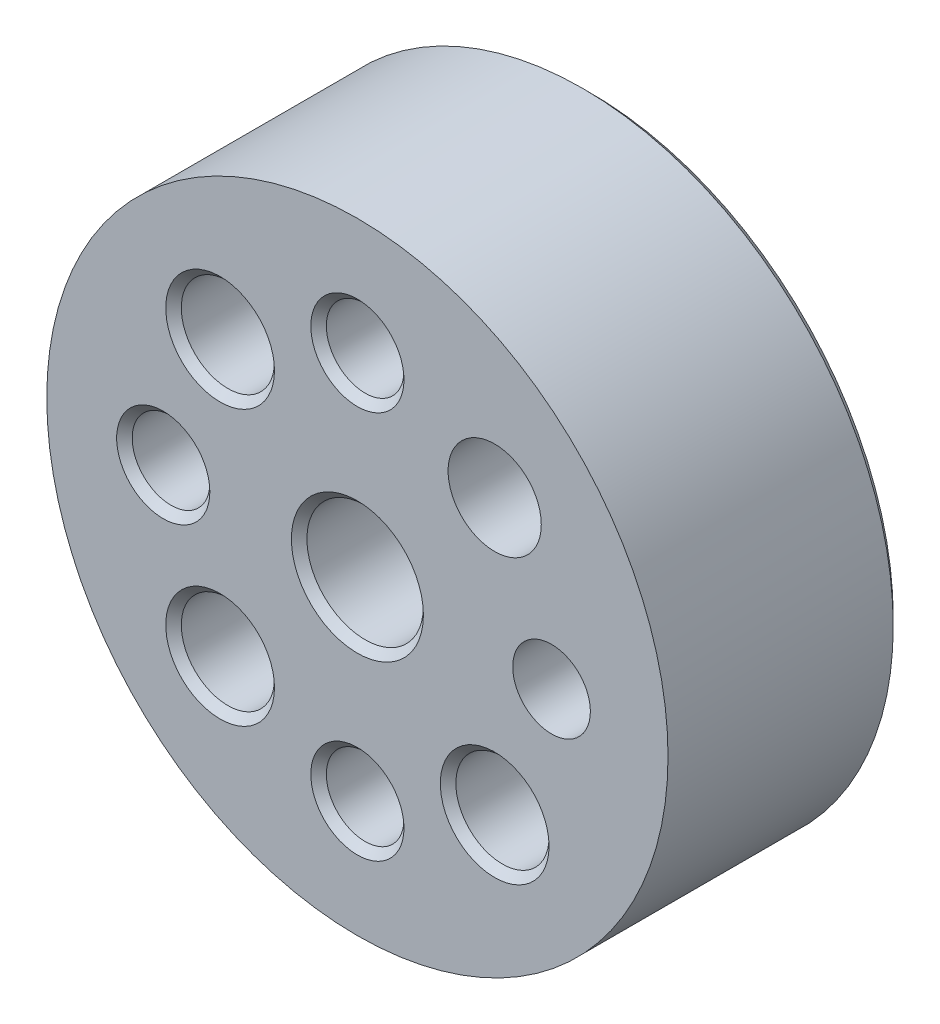
from build123d import *

# Parameters (mm, degrees)
SKIZZE1_R                       = 40
AUFSATZ_LINEAR_AUSTRAGEN1_DEPTH = 30
SKIZZE2_R                       = 5
SCHNITT_LINEAR_AUSTRAGEN1_DEPTH = 25
SKIZZE4_R                       = 6
SCHNITT_LINEAR_AUSTRAGEN5_DEPTH = 25
SKIZZE5_R                       = 7.5
SCHNITT_LINEAR_AUSTRAGEN6_DEPTH = 25
FASE1_SIZE                      = 1


with BuildPart() as part:
    # Skizze1 → Aufsatz-Linear austragen1 (new body)
    with BuildSketch(Plane.XY):
        Circle(SKIZZE1_R)
    extrude(amount=AUFSATZ_LINEAR_AUSTRAGEN1_DEPTH)

    # Skizze2 → Schnitt-Linear austragen1 (cut)
    with BuildSketch(Plane.XY.offset(30)):
        with Locations((25, 0)):
            Circle(SKIZZE2_R)
        with Locations((0, -25)):
            Circle(SKIZZE2_R)
        with Locations((-25, 0)):
            Circle(SKIZZE2_R)
        with Locations((0, 25)):
            Circle(SKIZZE2_R)
    extrude(amount=-SCHNITT_LINEAR_AUSTRAGEN1_DEPTH, mode=Mode.SUBTRACT)

    # Skizze4 → Schnitt-Linear austragen5 (cut)
    with BuildSketch(Plane.XY.offset(30)):
        with Locations((17.67766953, 17.67766953)):
            Circle(SKIZZE4_R)
        with Locations((17.67766953, -17.67766953)):
            Circle(SKIZZE4_R)
        with Locations((-17.67766953, -17.67766953)):
            Circle(SKIZZE4_R)
        with Locations((-17.67766953, 17.67766953)):
            Circle(SKIZZE4_R)
    extrude(amount=-SCHNITT_LINEAR_AUSTRAGEN5_DEPTH, mode=Mode.SUBTRACT)

    # Skizze5 → Schnitt-Linear austragen6 (cut)
    with BuildSketch(Plane.XY.offset(30)):
        Circle(SKIZZE5_R)
    extrude(amount=-SCHNITT_LINEAR_AUSTRAGEN6_DEPTH, mode=Mode.SUBTRACT)

    # Fase1
    fase1_edges = [part.edges().sort_by_distance(p)[0] for p in [
        (-40, 0, 0),
        (-7.5, 0, 30),
        (-30, 0, 30),
        (-23.67766953, -17.67766953, 30),
        (-5, -25, 30),
        (11.67766953, -17.67766953, 30),
        (20, 0, 5),
        (11.67766953, 17.67766953, 5),
        (-5, 25, 30),
        (-23.67766953, 17.67766953, 30),
    ]]
    chamfer(fase1_edges, length=FASE1_SIZE)


solid = part.part
